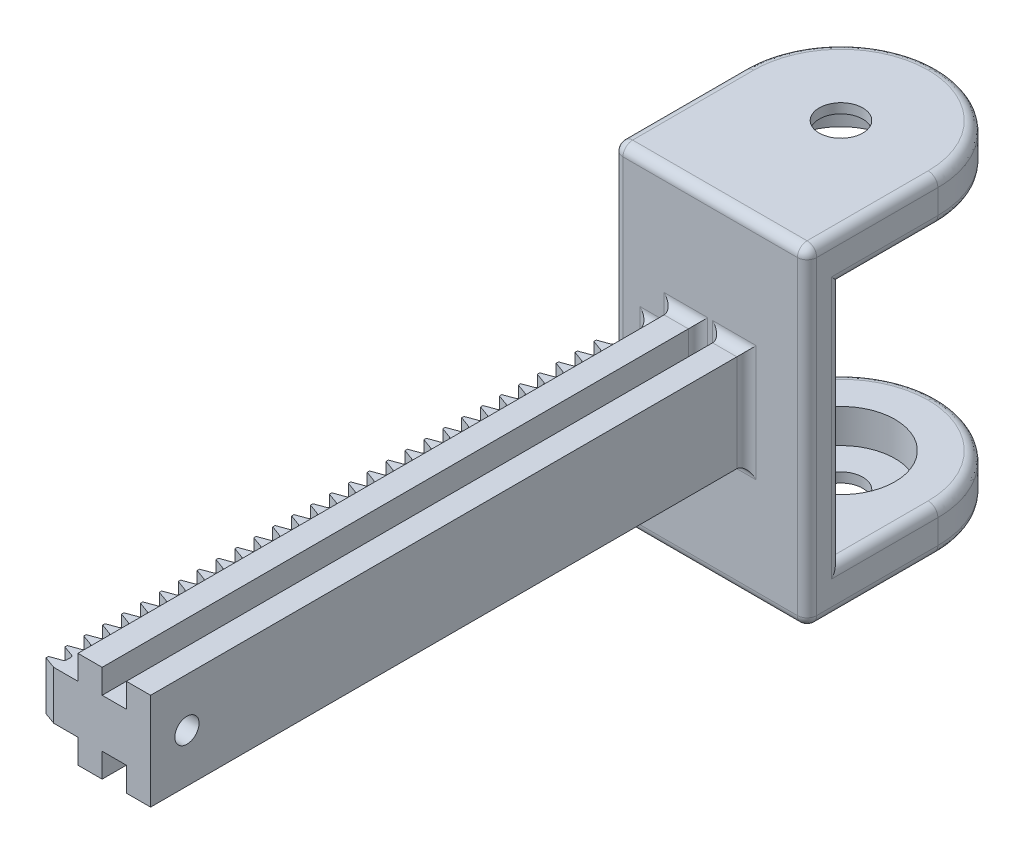
from build123d import *

# Parameters (mm, degrees)
CROQUIS2_W                        = 68
CROQUIS2_H                        = 40
SALIENTE_EXTRUIR1_DEPTH           = 7
CROQUIS3_W                        = 40
CROQUIS3_H                        = 9
SALIENTE_EXTRUIR2_DEPTH           = 40
CORTAR_EXTRUIR1_DEPTH             = 57
CORTAR_EXTRUIR1_DEPTH_BACK        = 7
CROQUIS4_R                        = 11.15
CROQUIS4_R_2                      = 4.5
CORTAR_EXTRUIR2_REACH             = 76.034
CROQUIS4_4_R                      = 4.5
CORTAR_EXTRUIR2_DIRECTION_2_REACH = 76.034
SALIENTE_EXTRUIR3_DEPTH           = 123
SALIENTE_EXTRUIR4_DEPTH           = 5
REDONDEO1_R                       = 0.5
CROQUIS9_R                        = 2.5
CORTAR_EXTRUIR3_DEPTH             = 5
REDONDEO2_SIZE                    = 20
REDONDEO4_R                       = 2


with BuildPart() as part:
    # Croquis2 → Saliente-Extruir1 (new body)
    with BuildSketch(Plane(origin=(0, 0, 0), x_dir=(0, 1, 0), z_dir=(0, 0, 1))):
        Rectangle(CROQUIS2_W, CROQUIS2_H)
    extrude(amount=SALIENTE_EXTRUIR1_DEPTH)

    # Croquis3 → Saliente-Extruir2 (add)
    with BuildSketch(Plane(origin=(0, 0, 0), x_dir=(1, 0, 0), z_dir=(0, 0, -1))):
        with Locations((0, -29.5)):
            Rectangle(CROQUIS3_W, CROQUIS3_H)
        with Locations((0, 29.5)):
            Rectangle(CROQUIS3_W, CROQUIS3_H)
    extrude(amount=SALIENTE_EXTRUIR2_DEPTH)

    # Croquis4 → Cortar-Extruir1 (cut, two sides: drawn at the far end of the back side and taken through both)
    # profile 1 of 2: a face of its own
    with BuildSketch(Plane.XZ.offset(-25).offset(-CORTAR_EXTRUIR1_DEPTH_BACK)):
        with Locations(Location((0, -20, 0), (0, 0, 180))):
            Circle(CROQUIS4_R)
        with Locations((0, -20)):
            Circle(CROQUIS4_R_2, mode=Mode.SUBTRACT)
    # profile 2 of 2: a face of its own
    with BuildSketch(Plane.XZ.offset(-25).offset(-CORTAR_EXTRUIR1_DEPTH_BACK)):
        with Locations((0, -20)):
            Circle(CROQUIS4_R_2)
    extrude(amount=CORTAR_EXTRUIR1_DEPTH + CORTAR_EXTRUIR1_DEPTH_BACK, mode=Mode.SUBTRACT)

    # Croquis4<4> → Cortar-Extruir2 (cut, up to next)
    with BuildSketch(Plane.XZ.offset(-25), mode=Mode.PRIVATE) as cortar_extruir2_sk1:
        with Locations((0, -20)):
            Circle(CROQUIS4_4_R)
    cortar_extruir2_tool1 = extrude(cortar_extruir2_sk1.sketch, amount=-CORTAR_EXTRUIR2_REACH, mode=Mode.PRIVATE) & part.part
    add(cortar_extruir2_tool1.solids().sort_by_distance((0, 25, -20))[0], mode=Mode.SUBTRACT)

    # Croquis4<4> → Cortar-Extruir2 direction 2 (cut, up to next)
    with BuildSketch(Plane.XZ.offset(-25), mode=Mode.PRIVATE) as cortar_extruir2_direction_2_sk1:
        with Locations((0, -20)):
            Circle(CROQUIS4_4_R)
    cortar_extruir2_direction_2_tool1 = extrude(cortar_extruir2_direction_2_sk1.sketch, amount=CORTAR_EXTRUIR2_DIRECTION_2_REACH, mode=Mode.PRIVATE) & part.part
    add(cortar_extruir2_direction_2_tool1.solids().sort_by_distance((0, 25, -20))[0], mode=Mode.SUBTRACT)

    # Croquis5 → Saliente-Extruir3 (add)
    with BuildSketch(Plane.XY.offset(7)):
        Polygon((-12.5, -5), (-7.5, -5), (-7.5, -10), (-2.5, -10), (-2.5, -5), (2.5, -5), (2.5, -10), (7.5, -10), (7.5, 10), (2.5, 10), (2.5, 5), (-2.5, 5), (-2.5, 10), (-7.5, 10), (-7.5, 5), (-12.5, 5), align=None)
    extrude(amount=SALIENTE_EXTRUIR3_DEPTH)

    # Croquis8 → Saliente-Extruir4 (add, symmetric)
    with BuildSketch(Plane(origin=(0, 0, 0), x_dir=(-1, 0, 0), z_dir=(0, 1, 0))):
        Polygon((15, 125.190074414), (12.5, 126.1), (12.5, 123.8), (15, 124.709925586), align=None)
        Polygon((15, 129.090074414), (12.5, 130), (12.5, 127.7), (15, 128.609925586), align=None)
        Polygon((15, 121.290074414), (12.5, 122.2), (12.5, 119.9), (15, 120.809925586), align=None)
        Polygon((15, 117.390074414), (12.5, 118.3), (12.5, 116), (15, 116.909925586), align=None)
        Polygon((15, 113.490074414), (12.5, 114.4), (12.5, 112.1), (15, 113.009925586), align=None)
        Polygon((15, 109.590074414), (12.5, 110.5), (12.5, 108.2), (15, 109.109925586), align=None)
        Polygon((15, 105.690074414), (12.5, 106.6), (12.5, 104.3), (15, 105.209925586), align=None)
        Polygon((15, 101.790074414), (12.5, 102.7), (12.5, 100.4), (15, 101.309925586), align=None)
        Polygon((15, 97.890074414), (12.5, 98.8), (12.5, 96.5), (15, 97.409925586), align=None)
        Polygon((15, 93.990074414), (12.5, 94.9), (12.5, 92.6), (15, 93.509925586), align=None)
        Polygon((15, 90.090074414), (12.5, 91), (12.5, 88.7), (15, 89.609925586), align=None)
        Polygon((15, 86.190074414), (12.5, 87.1), (12.5, 84.8), (15, 85.709925586), align=None)
        Polygon((15, 82.290074414), (12.5, 83.2), (12.5, 80.9), (15, 81.809925586), align=None)
        Polygon((15, 78.390074414), (12.5, 79.3), (12.5, 77), (15, 77.909925586), align=None)
        Polygon((15, 74.490074414), (12.5, 75.4), (12.5, 73.1), (15, 74.009925586), align=None)
        Polygon((15, 70.590074414), (12.5, 71.5), (12.5, 69.2), (15, 70.109925586), align=None)
        Polygon((15, 66.690074414), (12.5, 67.6), (12.5, 65.3), (15, 66.209925586), align=None)
        Polygon((15, 62.790074414), (12.5, 63.7), (12.5, 61.4), (15, 62.309925586), align=None)
        Polygon((15, 58.890074414), (12.5, 59.8), (12.5, 57.5), (15, 58.409925586), align=None)
        Polygon((15, 54.990074414), (12.5, 55.9), (12.5, 53.6), (15, 54.509925586), align=None)
        Polygon((15, 51.090074414), (12.5, 52), (12.5, 49.7), (15, 50.609925586), align=None)
        Polygon((15, 47.190074414), (12.5, 48.1), (12.5, 45.8), (15, 46.709925586), align=None)
        Polygon((15, 43.290074414), (12.5, 44.2), (12.5, 41.9), (15, 42.809925586), align=None)
        Polygon((15, 39.390074414), (12.5, 40.3), (12.5, 38), (15, 38.909925586), align=None)
        Polygon((15, 35.490074414), (12.5, 36.4), (12.5, 34.1), (15, 35.009925586), align=None)
        Polygon((15, 31.590074414), (12.5, 32.5), (12.5, 30.2), (15, 31.109925586), align=None)
        Polygon((15, 27.690074414), (12.5, 28.6), (12.5, 26.3), (15, 27.209925586), align=None)
        Polygon((15, 23.790074414), (12.5, 24.7), (12.5, 22.4), (15, 23.309925586), align=None)
        Polygon((15, 19.890074414), (12.5, 20.8), (12.5, 18.5), (15, 19.409925586), align=None)
        Polygon((15, 15.990074414), (12.5, 16.9), (12.5, 14.6), (15, 15.509925586), align=None)
    extrude(amount=SALIENTE_EXTRUIR4_DEPTH, both=True)

    # Redondeo1
    redondeo1_edges = [part.edges().sort_by_distance(p)[0] for p in [
        (-12.5, 0, 16.9),
        (-12.5, 0, 14.6),
        (-12.5, 0, 20.8),
        (-12.5, 0, 18.5),
        (-12.5, 0, 24.7),
        (-12.5, 0, 22.4),
        (-12.5, 0, 28.6),
        (-12.5, 0, 26.3),
        (-12.5, 0, 32.5),
        (-12.5, 0, 30.2),
        (-12.5, 0, 36.4),
        (-12.5, 0, 34.1),
        (-12.5, 0, 40.3),
        (-12.5, 0, 38),
        (-12.5, 0, 44.2),
        (-12.5, 0, 41.9),
        (-12.5, 0, 48.1),
        (-12.5, 0, 45.8),
        (-12.5, 0, 52),
        (-12.5, 0, 49.7),
        (-12.5, 0, 55.9),
        (-12.5, 0, 53.6),
        (-12.5, 0, 59.8),
        (-12.5, 0, 57.5),
        (-12.5, 0, 63.7),
        (-12.5, 0, 61.4),
        (-12.5, 0, 67.6),
        (-12.5, 0, 65.3),
        (-12.5, 0, 71.5),
        (-12.5, 0, 69.2),
        (-12.5, 0, 75.4),
        (-12.5, 0, 73.1),
        (-12.5, 0, 79.3),
        (-12.5, 0, 77),
        (-12.5, 0, 83.2),
        (-12.5, 0, 80.9),
        (-12.5, 0, 87.1),
        (-12.5, 0, 84.8),
        (-12.5, 0, 91),
        (-12.5, 0, 88.7),
        (-12.5, 0, 94.9),
        (-12.5, 0, 92.6),
        (-12.5, 0, 98.8),
        (-12.5, 0, 96.5),
        (-12.5, 0, 102.7),
        (-12.5, 0, 100.4),
        (-12.5, 0, 106.6),
        (-12.5, 0, 104.3),
        (-12.5, 0, 110.5),
        (-12.5, 0, 108.2),
        (-12.5, 0, 114.4),
        (-12.5, 0, 112.1),
        (-12.5, 0, 118.3),
        (-12.5, 0, 116),
        (-12.5, 0, 122.2),
        (-12.5, 0, 119.9),
        (-12.5, 0, 127.7),
        (-12.5, 0, 123.8),
        (-12.5, 0, 126.1),
    ]]
    fillet(redondeo1_edges, radius=REDONDEO1_R)

    # Croquis9 → Cortar-Extruir3 (cut)
    with BuildSketch(Plane.YZ.offset(7.5)):
        with Locations(Location((0, 122.5, 0), (0, 0, 270))):
            Circle(CROQUIS9_R)
    extrude(amount=-CORTAR_EXTRUIR3_DEPTH, mode=Mode.SUBTRACT)

    # Redondeo2
    # a fillet whose section is not a circle: 20 mm, written as the material it takes off along each edge
    with BuildSketch(Plane(origin=(20, 25, -40), x_dir=(0, 0, 1), z_dir=(0, -1, 0)), Plane(origin=(-20, -84, -40), x_dir=(0, 0, 1), z_dir=(0, 1, 0))) as redondeo2_piece_1:
        with BuildLine():
            Bezier((REDONDEO2_SIZE, 0), (0, 0), (0, REDONDEO2_SIZE), weights=[1, 0.707106781, 1])
            Line((0, REDONDEO2_SIZE), (0, 0))
            Line((0, 0), (REDONDEO2_SIZE, 0))
        make_face()
    extrude(amount=109, mode=Mode.SUBTRACT)
    with BuildSketch(Plane(origin=(20, -25, -40), x_dir=(0, 0, 1), z_dir=(0, 1, 0)), Plane(origin=(-20, 84, -40), x_dir=(0, 0, 1), z_dir=(0, -1, 0))) as redondeo2_piece_2:
        with BuildLine():
            Bezier((REDONDEO2_SIZE, 0), (0, 0), (0, -REDONDEO2_SIZE), weights=[1, 0.707106781, 1])
            Line((0, -REDONDEO2_SIZE), (0, 0))
            Line((0, 0), (REDONDEO2_SIZE, 0))
        make_face()
    extrude(amount=109, mode=Mode.SUBTRACT)

    # Redondeo4
    redondeo4_edges = [part.edges().sort_by_distance(p)[0] for p in [
        (0, 34, 7),
        (-20, 0, 0),
        (20, 0, 0),
        (20, -25, -10),
        (20, 25, -10),
        (-20, -25, -10),
        (-20, 25, -10),
        (-20, 0, 7),
        (0, -34, 7),
        (-5, 10, 7),
        (-7.5, 7.5, 7),
        (-10, 5, 7),
        (-12.5, 0, 7),
        (-10, -5, 7),
        (-7.5, -7.5, 7),
        (-5, -10, 7),
        (-2.5, -7.5, 7),
        (0, -5, 7),
        (2.5, -7.5, 7),
        (5, -10, 7),
        (7.5, 0, 7),
        (5, 10, 7),
        (2.5, 7.5, 7),
        (0, 5, 7),
        (-2.5, 7.5, 7),
        (-20, -34, -6.5),
        (-20, 34, -6.5),
        (20, 34, -6.5),
        (20, -34, -6.5),
        (20, 0, 7),
    ]]
    fillet(redondeo4_edges, radius=REDONDEO4_R)


solid = part.part
